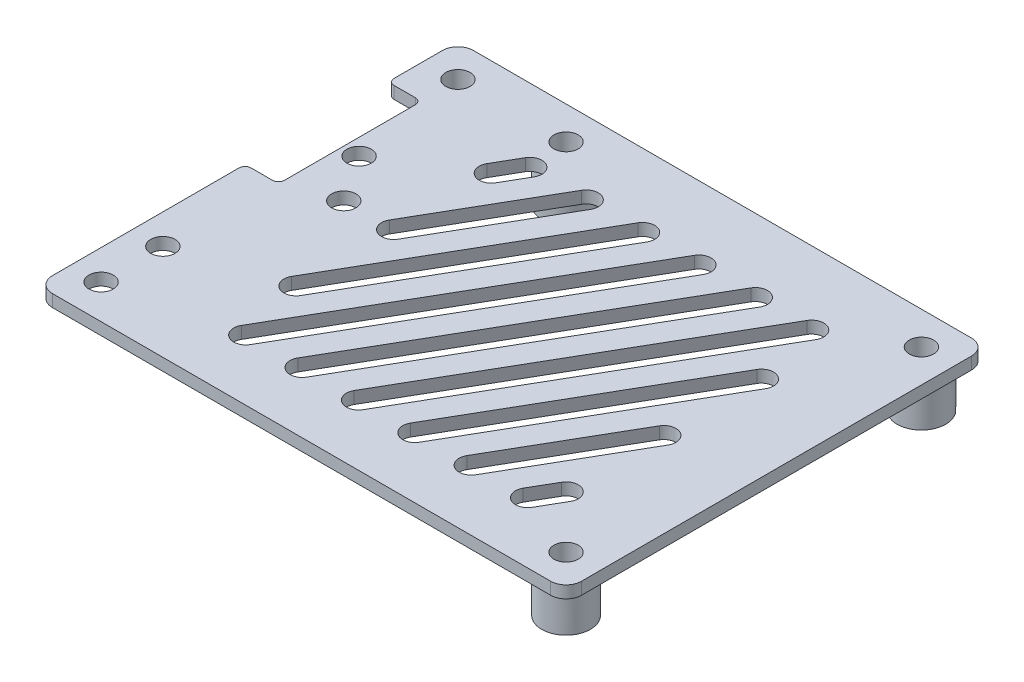
from build123d import *

# Parameters (mm, degrees)
SKETCH1_W           = 87
SKETCH1_H           = 69.22
SKETCH1_R           = 2
BOSS_EXTRUDE1_DEPTH = 2
BOSS_EXTRUDE2_START = 7
SKETCH2_R           = 4
SKETCH2_R_2         = 2
BOSS_EXTRUDE2_DEPTH = 7
SKETCH3_W           = 5.5
SKETCH3_H           = 23.5
CUT_EXTRUDE1_DEPTH  = 7
SKETCH4_R           = 2
CUT_EXTRUDE2_DEPTH  = 7
CUT_EXTRUDE3_DEPTH  = 5
SKETCH6_R           = 2
CUT_EXTRUDE4_DEPTH  = 10
FILLET1_R           = 1
FILLET2_R           = 2.54


with BuildPart() as part:
    # Sketch1 → Boss-Extrude1 (new body)
    with BuildSketch(Plane(origin=(0, 0, 0), x_dir=(1, 0, 0), z_dir=(0, 1, 0))):
        Rectangle(SKETCH1_W, SKETCH1_H)
        with BuildLine():
            ThreePointArc((40.1, -29.21), (39.947759065, -29.975366865), (39.514213562, -30.624213562))
            ThreePointArc((39.514213562, -30.624213562), (36.252240935, -28.444633135), (40.1, -29.21))
        make_face(mode=Mode.SUBTRACT)
        with Locations((-38.1, 29.21)):
            Circle(SKETCH1_R, mode=Mode.SUBTRACT)
        with Locations((-20.32, 29.21)):
            Circle(SKETCH1_R, mode=Mode.SUBTRACT)
        with Locations((38.1, 29.21)):
            Circle(SKETCH1_R, mode=Mode.SUBTRACT)
    extrude(amount=BOSS_EXTRUDE1_DEPTH)

    # Sketch2 → Boss-Extrude2 (add)
    # profile 1 of 4: a face of its own
    with BuildSketch(Plane.XZ.offset(BOSS_EXTRUDE2_START)):
        with Locations((38.1, -29.21)):
            Circle(SKETCH2_R)
        with Locations((38.1, -29.21)):
            Circle(SKETCH2_R_2, mode=Mode.SUBTRACT)
    # profile 2 of 4: a face of its own
    with BuildSketch(Plane.XZ.offset(BOSS_EXTRUDE2_START)):
        with Locations((-20.32, -29.21)):
            Circle(SKETCH2_R)
        with Locations((-20.32, -29.21)):
            Circle(SKETCH2_R_2, mode=Mode.SUBTRACT)
    # profile 3 of 4: a face of its own
    with BuildSketch(Plane.XZ.offset(BOSS_EXTRUDE2_START)):
        with Locations((-38.1, -29.21)):
            Circle(SKETCH2_R)
        with Locations((-38.1, -29.21)):
            Circle(SKETCH2_R_2, mode=Mode.SUBTRACT)
    # profile 4 of 4: a face of its own
    with BuildSketch(Plane.XZ.offset(BOSS_EXTRUDE2_START)):
        with Locations((38.1, 29.21)):
            Circle(SKETCH2_R)
        with Locations((38.1, 29.21)):
            Circle(SKETCH2_R_2, mode=Mode.SUBTRACT)
    extrude(amount=-BOSS_EXTRUDE2_DEPTH)

    # Sketch3 → Cut-Extrude1 (cut)
    with BuildSketch(Plane(origin=(0, 2, 0), x_dir=(1, 0, 0), z_dir=(0, 1, 0))):
        with Locations((-40.75, 11.36)):
            Rectangle(SKETCH3_W, SKETCH3_H)
    extrude(amount=-CUT_EXTRUDE1_DEPTH, mode=Mode.SUBTRACT)

    # Sketch4 → Cut-Extrude2 (cut)
    with BuildSketch(Plane(origin=(0, 2, 0), x_dir=(1, 0, 0), z_dir=(0, 1, 0))):
        with Locations((-38.59, -28.97)):
            Circle(SKETCH4_R)
        with Locations((-38.59, -18.81)):
            Circle(SKETCH4_R)
        with Locations((-35.3, 10.16)):
            Circle(SKETCH4_R)
    extrude(amount=-CUT_EXTRUDE2_DEPTH, mode=Mode.SUBTRACT)

    # Sketch5 → Cut-Extrude3 (cut)
    with BuildSketch(Plane(origin=(0, 2, 0), x_dir=(1, 0, 0), z_dir=(0, 1, 0))):
        with BuildLine():
            Line((-23.732050808, 19.61), (-21.422649731, 23.61))
            ThreePointArc((-21.422649731, 23.61), (-18.690598923, 24.342050808), (-17.958548116, 21.61))
            Line((-17.958548116, 21.61), (-20.267949192, 17.61))
            ThreePointArc((-20.267949192, 17.61), (-23, 16.877949192), (-23.732050808, 19.61))
        make_face()
        with BuildLine():
            Line((-23.732050808, 3.557422926), (-12.154690036, 23.61))
            ThreePointArc((-12.154690036, 23.61), (-9.422639229, 24.342050808), (-8.690588421, 21.61))
            Line((-8.690588421, 21.61), (-20.267949192, 1.557422926))
            ThreePointArc((-20.267949192, 1.557422926), (-23, 0.825372119), (-23.732050808, 3.557422926))
        make_face()
        with BuildLine():
            Line((-23.732050808, -12.495154147), (-2.886730341, 23.61))
            ThreePointArc((-2.886730341, 23.61), (-0.154679534, 24.342050808), (0.577371274, 21.61))
            Line((0.577371274, 21.61), (-20.267949192, -14.495154147))
            ThreePointArc((-20.267949192, -14.495154147), (-23, -15.227204955), (-23.732050808, -12.495154147))
        make_face()
        with BuildLine():
            Line((9.845330968, 21.61), (-17.417148743, -25.61))
            ThreePointArc((-17.417148743, -25.61), (-20.14919955, -26.342050808), (-20.881250358, -23.61))
            Line((-20.881250358, -23.61), (6.381229353, 23.61))
            ThreePointArc((6.381229353, 23.61), (9.113280161, 24.342050808), (9.845330968, 21.61))
        make_face()
        with BuildLine():
            Line((-11.613290663, -23.61), (15.649189048, 23.61))
            ThreePointArc((15.649189048, 23.61), (18.381239856, 24.342050808), (19.113290663, 21.61))
            Line((19.113290663, 21.61), (-8.149189048, -25.61))
            ThreePointArc((-8.149189048, -25.61), (-10.881239856, -26.342050808), (-11.613290663, -23.61))
        make_face()
        with BuildLine():
            Line((28.381250358, 21.61), (1.118770647, -25.61))
            ThreePointArc((1.118770647, -25.61), (-1.613280161, -26.342050808), (-2.345330968, -23.61))
            Line((-2.345330968, -23.61), (24.917148743, 23.61))
            ThreePointArc((24.917148743, 23.61), (27.64919955, 24.342050808), (28.381250358, 21.61))
        make_face()
        with BuildLine():
            Line((6.922628726, -23.61), (27.767949192, 12.495154147))
            ThreePointArc((27.767949192, 12.495154147), (30.5, 13.227204955), (31.232050808, 10.495154147))
            Line((31.232050808, 10.495154147), (10.386730341, -25.61))
            ThreePointArc((10.386730341, -25.61), (7.654679534, -26.342050808), (6.922628726, -23.61))
        make_face()
        with BuildLine():
            Line((31.232050808, -5.557422926), (19.654690036, -25.61))
            ThreePointArc((19.654690036, -25.61), (16.922639229, -26.342050808), (16.190588421, -23.61))
            Line((16.190588421, -23.61), (27.767949192, -3.557422926))
            ThreePointArc((27.767949192, -3.557422926), (30.5, -2.825372119), (31.232050808, -5.557422926))
        make_face()
        with BuildLine():
            Line((25.458548116, -23.61), (27.767949192, -19.61))
            ThreePointArc((27.767949192, -19.61), (30.5, -18.877949192), (31.232050808, -21.61))
            Line((31.232050808, -21.61), (28.922649731, -25.61))
            ThreePointArc((28.922649731, -25.61), (26.190598923, -26.342050808), (25.458548116, -23.61))
        make_face()
    extrude(amount=-CUT_EXTRUDE3_DEPTH, mode=Mode.SUBTRACT)

    # Sketch6 → Cut-Extrude4 (cut)
    with BuildSketch(Plane(origin=(0, 2, 0), x_dir=(1, 0, 0), z_dir=(0, 1, 0))):
        with Locations((-30.2, 2.54)):
            Circle(SKETCH6_R)
    extrude(amount=-CUT_EXTRUDE4_DEPTH, mode=Mode.SUBTRACT)

    # Fillet1
    fillet1_edges = [part.edges().sort_by_distance(p)[0] for p in [
        (-38, 1, 0.39),
        (-43.5, 1, 0.39),
        (-38, 1, -23.11),
        (-43.5, 1, -23.11),
    ]]
    fillet(fillet1_edges, radius=FILLET1_R)

    # Fillet2
    fillet2_edges = [part.edges().sort_by_distance(p)[0] for p in [
        (43.5, 1, -34.61),
        (43.5, 1, 34.61),
        (-43.5, 1, 34.61),
        (-43.5, 1, -34.61),
    ]]
    fillet(fillet2_edges, radius=FILLET2_R)


solid = part.part
